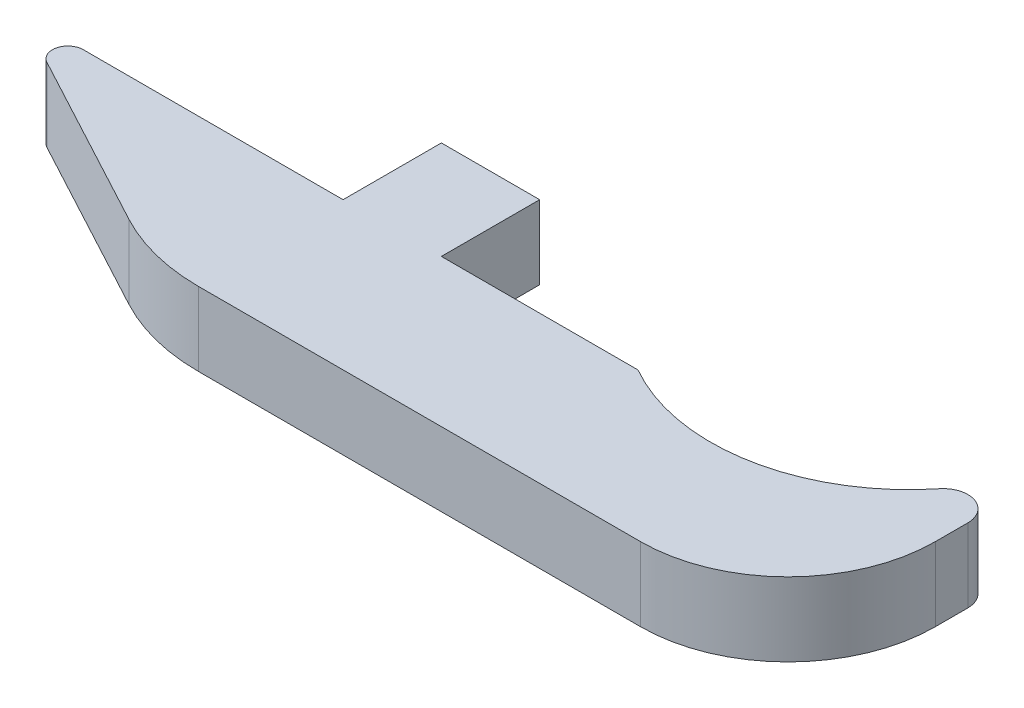
from build123d import *

# Parameters (mm, degrees)
BOSS_EXTRUDE1_DEPTH = 4.7625
FILLET1_R           = 9.525
FILLET2_R           = 1.5875
FILLET4_R           = 12.7
BOSS_EXTRUDE2_DEPTH = 4.7625
FILLET5_R           = 1


with BuildPart() as part:
    # Sketch1 → Boss-Extrude1 (new body)
    with BuildSketch(Plane(origin=(0, 0, 0), x_dir=(1, 0, 0), z_dir=(0, 1, 0))):
        with BuildLine():
            ThreePointArc((62.20459999999994, 11.1252), (55.80558311010998, 0.02506657124609291), (42.993098926305386, 3.1797e-13))
            Line((42.993098926305315, 3.26e-15), (3.17499999999972, 1.85e-15))
            Line((3.174999999999723, -3.02e-15), (20.929599999999944, -9.525))
            Line((20.929599999999944, -9.525), (62.20459999999994, -9.525))
            Line((62.20459999999994, -9.525), (62.20459999999994, 11.125200000000005))
        make_face()
    extrude(amount=BOSS_EXTRUDE1_DEPTH)

    # Fillet1
    fillet1_edges = [part.edges().sort_by_distance(p)[0] for p in [
        (62.20459999999994, 2.38125, 9.525),
    ]]
    fillet(fillet1_edges, radius=FILLET1_R)

    # Fillet2
    fillet2_edges = [part.edges().sort_by_distance(p)[0] for p in [
        (62.20459999999994, 2.38125, -11.125200000000003),
    ]]
    fillet(fillet2_edges, radius=FILLET2_R)

    # Fillet4
    fillet4_edges = [part.edges().sort_by_distance(p)[0] for p in [
        (20.929599999999944, 2.38125, 9.525),
    ]]
    fillet(fillet4_edges, radius=FILLET4_R)

    # Sketch2 → Boss-Extrude2 (add)
    with BuildSketch(Plane.XZ):
        Polygon((23.937499999999932, -6.349999999999999), (30.287499999999934, -6.349999999999999), (30.287499999999934, 5.33e-15), (23.937499999999932, 4.43e-15), align=None)
    extrude(amount=-BOSS_EXTRUDE2_DEPTH)

    # Fillet5
    fillet5_edges = [part.edges().sort_by_distance(p)[0] for p in [
        (3.174999999999722, 2.38125, 5.9e-16),
    ]]
    fillet(fillet5_edges, radius=FILLET5_R)


solid = part.part
